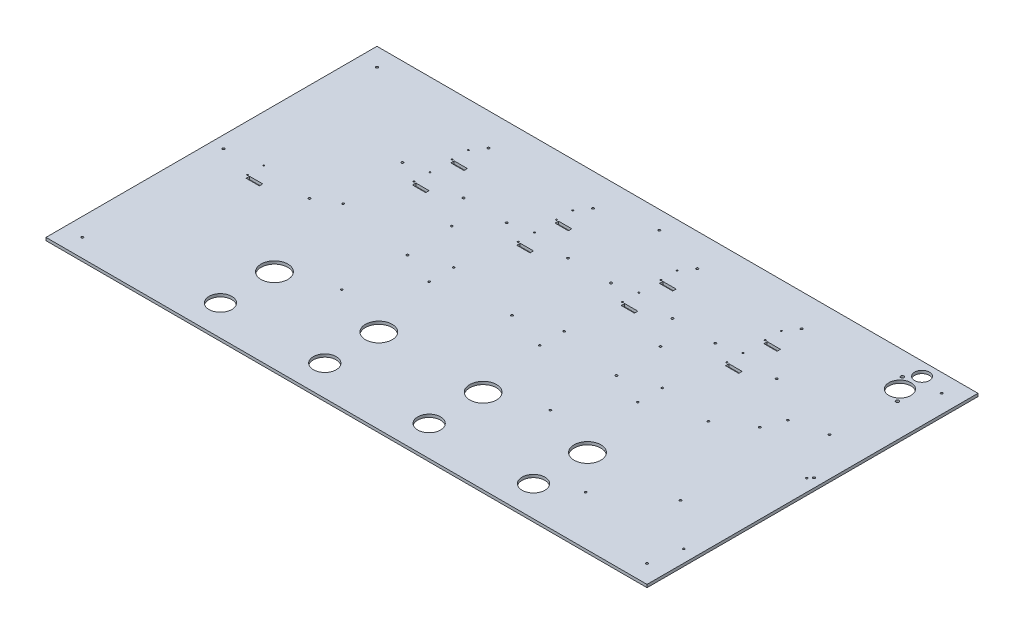
from build123d import *

# Parameters (mm, degrees)
SKETCH1_W                     = 660.4
SKETCH1_H                     = 381
SHEET_DEPTH                   = 2.9972
SKETCH2_7_W                   = 13.716
SKETCH2_7_H                   = 3.556
SKETCH2_7_R                   = 11.811
SKETCH2_7_R_2                 = 13.843
SKETCH2_7_R_3                 = 0.762
CHANNEL_CONTROLS_BOTTOM_DEPTH = 382.223390164
LPATTERN1_COUNT               = 4
LPATTERN1_PITCH               = 107.95
SKETCH5_5_W                   = 13.716
SKETCH5_5_H                   = 3.556
SKETCH5_5_R                   = 0.762
CUT_EXTRUDE2_DEPTH            = 382.223390164
SKETCH6_R                     = 7.62
SKETCH6_R_2                   = 11.43
SKETCH6_R_3                   = 1.651
MIC_DEPTH                     = 382.223390164
SKETCH18_R                    = 1.143
INSIDE_SCREW_HOLES_DEPTH      = 382.223390164
SKETCH17_W                    = 660.4
SKETCH17_H                    = 381
SKETCH17_W_2                  = 621.792
SKETCH17_H_2                  = 342.392
CUT_IN_EDGES_DEPTH            = 382.223390164
SKETCH19_R                    = 1.016
PCB_MOUNT_DEPTH               = 2.54
SKETCH20_R                    = 1.016
CABLE_MANAGEMENT_DEPTH        = 2.54


with BuildPart() as part:
    # Sketch1 → Sheet (new body)
    with BuildSketch(Plane(origin=(0, 0, 0), x_dir=(1, 0, 0), z_dir=(0, 1, 0))):
        Rectangle(SKETCH1_W, SKETCH1_H)
    extrude(amount=SHEET_DEPTH)

    # Sketch2<7> → Channel Controls - Bottom (cut, through all)
    with BuildSketch(Plane(origin=(0, 2.9972, 0), x_dir=(1, 0, 0), z_dir=(0, 1, 0))):
        with Locations((-161.417, 106.68)):
            Rectangle(SKETCH2_7_W, SKETCH2_7_H)
        with Locations((-161.417, 67.056)):
            Rectangle(SKETCH2_7_W, SKETCH2_7_H)
        with Locations((-161.925, -139.7)):
            Circle(SKETCH2_7_R)
        with Locations((-161.925, -83.82)):
            Circle(SKETCH2_7_R_2)
        with Locations((-170.561, 125.476)):
            Circle(SKETCH2_7_R_3)
        with Locations((-170.561, 108.712)):
            Circle(SKETCH2_7_R_3)
        with Locations((-170.561, 85.852)):
            Circle(SKETCH2_7_R_3)
        with Locations((-170.561, 69.088)):
            Circle(SKETCH2_7_R_3)
    channel_controls_bottom = extrude(amount=-CHANNEL_CONTROLS_BOTTOM_DEPTH, mode=Mode.SUBTRACT)

    # LPattern1: Channel Controls - Bottom ×4
    with Locations(*[(i * LPATTERN1_PITCH, 0, 0) for i in range(1, LPATTERN1_COUNT)]):
        add(channel_controls_bottom, mode=Mode.SUBTRACT)

    # Sketch5<5> → Cut-Extrude2 (cut, through all)
    with BuildSketch(Plane(origin=(0, 2.9972, 0), x_dir=(1, 0, 0), z_dir=(0, 1, 0))):
        with Locations((-253.492, -12.954)):
            Rectangle(SKETCH5_5_W, SKETCH5_5_H)
        with Locations((-262.636, 5.842)):
            Circle(SKETCH5_5_R)
        with Locations((-262.636, -10.922)):
            Circle(SKETCH5_5_R)
    extrude(amount=-CUT_EXTRUDE2_DEPTH, mode=Mode.SUBTRACT)

    # Sketch6 → Mic (cut, through all)
    with BuildSketch(Plane(origin=(0, 2.9972, 0), x_dir=(1, 0, 0), z_dir=(0, 1, 0))):
        with Locations((266.7, 157.48)):
            Circle(SKETCH6_R)
        with Locations((266.7, 134.62)):
            Circle(SKETCH6_R_2)
        with Locations((257.048, 146.812)):
            Circle(SKETCH6_R_3)
        with Locations((276.352, 122.428)):
            Circle(SKETCH6_R_3)
    extrude(amount=-MIC_DEPTH, mode=Mode.SUBTRACT)

    # Sketch18 → Inside Screw Holes (cut, through all)
    with BuildSketch(Plane(origin=(0, 2.9972, 0), x_dir=(1, 0, 0), z_dir=(0, 1, 0))):
        with Locations((-193.675, 80.158564581)):
            Circle(SKETCH18_R)
        with Locations((-161.925, 137.7044104)):
            Circle(SKETCH18_R)
        with Locations((-298.45, 0)):
            Circle(SKETCH18_R)
        with Locations((-209.55, 0)):
            Circle(SKETCH18_R)
        with Locations((-107.95, 0)):
            Circle(SKETCH18_R)
        with Locations((-292.1, 152.4)):
            Circle(SKETCH18_R)
        with Locations((0, 152.4)):
            Circle(SKETCH18_R)
        with Locations((-130.175, 80.158564581)):
            Circle(SKETCH18_R)
        with Locations((301.701065048, 10.72901122)):
            Circle(SKETCH18_R)
        with Locations((228.429380072, 27.954149694)):
            Circle(SKETCH18_R)
        with Locations((271.116831878, 57.283623384)):
            Circle(SKETCH18_R)
        with Locations((292.1, 152.4)):
            Circle(SKETCH18_R)
        Circle(SKETCH18_R)
        with Locations((107.95, 0)):
            Circle(SKETCH18_R)
        with Locations((252.912933296, -78.628784773)):
            Circle(SKETCH18_R)
        with Locations((292.1, -152.4)):
            Circle(SKETCH18_R)
        with Locations((-292.1, -152.4)):
            Circle(SKETCH18_R)
        with Locations((-53.975, 137.7044104)):
            Circle(SKETCH18_R)
        with Locations((-85.725, 80.158564581)):
            Circle(SKETCH18_R)
        with Locations((-22.225, 80.158564581)):
            Circle(SKETCH18_R)
        with Locations((53.975, 137.7044104)):
            Circle(SKETCH18_R)
        with Locations((22.225, 80.158564581)):
            Circle(SKETCH18_R)
        with Locations((85.725, 80.158564581)):
            Circle(SKETCH18_R)
        with Locations((161.925, 137.7044104)):
            Circle(SKETCH18_R)
        with Locations((130.175, 80.158564581)):
            Circle(SKETCH18_R)
        with Locations((193.675, 80.158564581)):
            Circle(SKETCH18_R)
    extrude(amount=-INSIDE_SCREW_HOLES_DEPTH, mode=Mode.SUBTRACT)

    # Sketch17 → Cut In Edges (cut, through all)
    with BuildSketch(Plane(origin=(0, 2.9972, 0), x_dir=(1, 0, 0), z_dir=(0, 1, 0))):
        Rectangle(SKETCH17_W, SKETCH17_H)
        Rectangle(SKETCH17_W_2, SKETCH17_H_2, mode=Mode.SUBTRACT)
    extrude(amount=-CUT_IN_EDGES_DEPTH, mode=Mode.SUBTRACT)

    # Sketch19 → PCB Mount (cut)
    with BuildSketch(Plane(origin=(0, 2.9972, 0), x_dir=(1, 0, 0), z_dir=(0, 1, 0))):
        with Locations((196.596, -120.396)):
            Circle(SKETCH19_R)
        with Locations((298.196, -120.396)):
            Circle(SKETCH19_R)
        with Locations((196.596, 6.604)):
            Circle(SKETCH19_R)
        with Locations((298.196, 6.604)):
            Circle(SKETCH19_R)
    extrude(amount=-PCB_MOUNT_DEPTH, mode=Mode.SUBTRACT)

    # Sketch20 → Cable Management (cut)
    with BuildSketch(Plane(origin=(0, 2.9972, 0), x_dir=(1, 0, 0), z_dir=(0, 1, 0))):
        with Locations((-111.125, 48.879696065)):
            Circle(SKETCH20_R)
        with Locations((104.775, 48.879696065)):
            Circle(SKETCH20_R)
        with Locations((104.775, -65.017488446)):
            Circle(SKETCH20_R)
        with Locations((-111.125, -65.017488446)):
            Circle(SKETCH20_R)
        with Locations((-73.025, 12.7)):
            Circle(SKETCH20_R)
        with Locations((-187.325, 12.7)):
            Circle(SKETCH20_R)
        with Locations((142.875, 12.7)):
            Circle(SKETCH20_R)
        with Locations((236.577440658, 48.879696065)):
            Circle(SKETCH20_R)
        with Locations((41.275, 12.7)):
            Circle(SKETCH20_R)
        with Locations((142.875, -12.7)):
            Circle(SKETCH20_R)
        with Locations((41.275, -12.7)):
            Circle(SKETCH20_R)
        with Locations((-73.025, -12.7)):
            Circle(SKETCH20_R)
    extrude(amount=-CABLE_MANAGEMENT_DEPTH, mode=Mode.SUBTRACT)


solid = part.part
